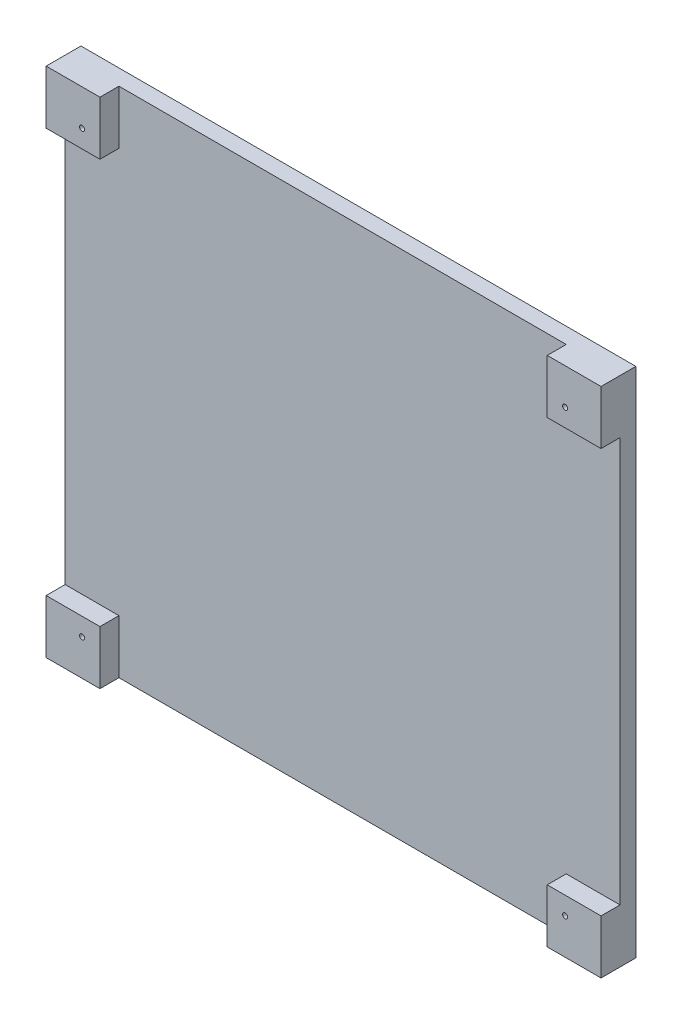
from build123d import *

# Parameters (mm, degrees)
SKETCH1_W           = 161.892
SKETCH1_H           = 175.354
BOSS_EXTRUDE1_DEPTH = 5
SKETCH2_W           = 17
SKETCH2_H           = 17
BOSS_EXTRUDE2_DEPTH = 6
SKETCH3_R           = 0.8
CUT_EXTRUDE1_DEPTH  = 120.835350565


with BuildPart() as part:
    # Sketch1 → Boss-Extrude1 (new body)
    with BuildSketch(Plane(origin=(0, 0, 0), x_dir=(0, 1, 0), z_dir=(0, 0, 1))):
        Rectangle(SKETCH1_W, SKETCH1_H)
    extrude(amount=BOSS_EXTRUDE1_DEPTH)

    # Sketch2 → Boss-Extrude2 (add)
    with BuildSketch(Plane.XY.offset(5)):
        with Locations((79.177, 72.446)):
            Rectangle(SKETCH2_W, SKETCH2_H)
        with Locations((-79.177, 72.446)):
            Rectangle(SKETCH2_W, SKETCH2_H)
        with Locations((79.177, -72.446)):
            Rectangle(SKETCH2_W, SKETCH2_H)
        with Locations((-79.177, -72.446)):
            Rectangle(SKETCH2_W, SKETCH2_H)
    extrude(amount=BOSS_EXTRUDE2_DEPTH)

    # Sketch3 → Cut-Extrude1 (cut, through all)
    with BuildSketch(Plane.XY.offset(11)):
        with Locations((-76.327, 69.596)):
            Circle(SKETCH3_R)
        with Locations((-76.327, -69.596)):
            Circle(SKETCH3_R)
        with Locations((76.327, -69.596)):
            Circle(SKETCH3_R)
        with Locations((76.327, 69.596)):
            Circle(SKETCH3_R)
    extrude(amount=-CUT_EXTRUDE1_DEPTH, mode=Mode.SUBTRACT)


solid = part.part
